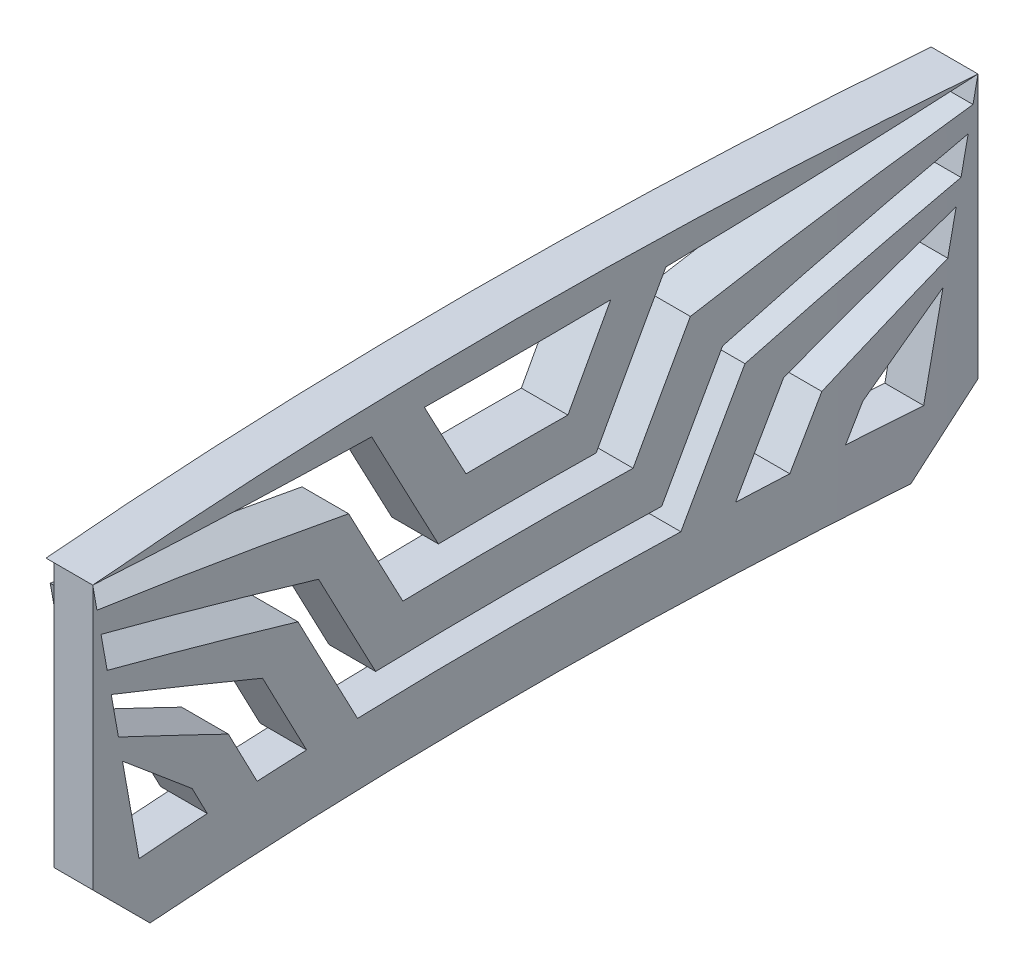
from build123d import *

# Parameters (mm, degrees)
BOSS_EXTRUDE1_DEPTH      = 25
CUT_EXTRUDE1_DEPTH       = 80.24352506
CUT_EXTRUDE1_DEPTH_BACK  = 80.24352506
SKETCH4_W                = 163.693306888
SKETCH4_H                = 40.024571377
CUT_EXTRUDE3_START       = 2.86496876
CUT_EXTRUDE3_DEPTH       = 1.701411362
CUT_EXTRUDE3_START_2     = 4
CUT_EXTRUDE3_2_DEPTH     = 21
CUT_EXTRUDE3_START_3     = -19
CUT_EXTRUDE3_3_OUTLINE_W = 1.566380122
CUT_EXTRUDE3_3_OUTLINE_H = 41.625991854
CUT_EXTRUDE3_3_DEPTH     = 3.634613826
CUT_EXTRUDE3_START_4     = -15.365386174
CUT_EXTRUDE3_4_OUTLINE_W = 1.566380122
CUT_EXTRUDE3_4_OUTLINE_H = 4.374008146
CUT_EXTRUDE3_4_DEPTH     = 52.325901807
CUT_EXTRUDE8_DEPTH       = 40.481678639
CUT_EXTRUDE8_DEPTH_BACK  = 40.481678639


with BuildPart() as part:
    # Sketch1 → Boss-Extrude1 (new body)
    with BuildSketch(Plane(origin=(0, 0, 0), x_dir=(1, 0, 0), z_dir=(0, 1, 0))):
        with BuildLine():
            Line((4.907868645, 71.729937519), (8.36496876, 71.729937519))
            Line((8.36496876, 71.729937519), (8.36496876, 74.729937519))
            Line((8.36496876, 74.729937519), (4.907868645, 74.729937519))
            ThreePointArc((4.907868645, 74.729937519), (1.752478587, 73.608534376), (0.01247426, 70.74734295))
            ThreePointArc((0.01247426, 70.74734295), (-7.13503124, 1.229937519), (0.01247426, -68.287467911))
            ThreePointArc((0.01247426, -68.287467911), (1.752478587, -71.148659338), (4.907868645, -72.270062481))
            Line((4.907868645, -72.270062481), (8.36496876, -72.270062481))
            Line((8.36496876, -72.270062481), (8.36496876, -69.270062481))
            Line((8.36496876, -69.270062481), (4.907868645, -69.270062481))
            ThreePointArc((4.907868645, -69.270062481), (3.645712622, -68.821501224), (2.949710891, -67.677024653))
            ThreePointArc((2.949710891, -67.677024653), (-4.13503124, 1.229937519), (2.949710891, 70.136899691))
            ThreePointArc((2.949710891, 70.136899691), (3.645712622, 71.281376262), (4.907868645, 71.729937519))
        make_face()
    extrude(amount=BOSS_EXTRUDE1_DEPTH)

    # Sketch4 → Cut-Extrude1 (cut, two sides: drawn at the far end of the back side and taken through both)
    with BuildSketch(Plane(origin=(0, 0, 0), x_dir=(0, 0, -1), z_dir=(1, 0, 0)).offset(-CUT_EXTRUDE1_DEPTH_BACK)):
        with Locations((-1.406411494, 10.890491369)):
            Rectangle(SKETCH4_W, SKETCH4_H)
        Polygon((25.729937519, 4), (-23.270062481, 4), (-27.270062481, 8), (-27.270062481, 25), (29.729937519, 25), (29.729937519, 8), align=None, mode=Mode.SUBTRACT)
    extrude(amount=CUT_EXTRUDE1_DEPTH + CUT_EXTRUDE1_DEPTH_BACK, mode=Mode.SUBTRACT)

    # Cut-Extrude3: read off the stored shape, not the designer's step
    # Cut-Extrude3 outline → Cut-Extrude3 (cut)
    with BuildSketch(Plane(origin=(-10, 0, 0), x_dir=(0, 0, -1), z_dir=(1, 0, 0)).offset(CUT_EXTRUDE3_START)):
        Polygon((26.491842281, 8), (-24.031967243, 8), (-27.270062481, 25), (-27.270062481, 8), (-23.270062481, 4), (25.729937519, 4), (29.729937519, 8), (29.729937519, 25), align=None)
    extrude(amount=CUT_EXTRUDE3_DEPTH, mode=Mode.SUBTRACT)

    # Cut-Extrude3 2 outline → Cut-Extrude3 2 (add)
    with BuildSketch(Plane(origin=(0, 0, 0), x_dir=(1, 0, 0), z_dir=(0, 1, 0)).offset(CUT_EXTRUDE3_START_2)):
        with BuildLine():
            ThreePointArc((-5.433619878, 29.729937519), (-6.63503124, 1.229937519), (-5.433619878, -27.270062481))
            Line((-5.433619878, -27.270062481), (-5.433619878, 29.729937519))
        make_face()
    extrude(amount=CUT_EXTRUDE3_2_DEPTH)

    # Cut-Extrude3 3 outline → Cut-Extrude3 3 (cut)
    with BuildSketch(Plane(origin=(0, 0, 0), x_dir=(1, 0, 0), z_dir=(0, 0.7071067811865476, 0.7071067811865476)).offset(CUT_EXTRUDE3_START_3)):
        with Locations((-6.216809939, 7.187004073)):
            Rectangle(CUT_EXTRUDE3_3_OUTLINE_W, CUT_EXTRUDE3_3_OUTLINE_H)
    extrude(amount=CUT_EXTRUDE3_3_DEPTH, mode=Mode.SUBTRACT)

    # Cut-Extrude3 4 outline → Cut-Extrude3 4 (cut)
    with BuildSketch(Plane(origin=(0, 0, 0), x_dir=(1, 0, 0), z_dir=(0, 0.7071067811865476, 0.7071067811865476)).offset(CUT_EXTRUDE3_START_4)):
        with Locations((-6.216809939, -15.812995927)):
            Rectangle(CUT_EXTRUDE3_4_OUTLINE_W, CUT_EXTRUDE3_4_OUTLINE_H)
    extrude(amount=CUT_EXTRUDE3_4_DEPTH, mode=Mode.SUBTRACT)

    # Sketch8 → Cut-Extrude8 (cut, two sides: drawn at the far end of the back side and taken through both)
    with BuildSketch(Plane(origin=(-10, 0, 0), x_dir=(0, 0, -1), z_dir=(1, 0, 0)).offset(-CUT_EXTRUDE8_DEPTH_BACK)):
        with BuildLine():
            Line((6.308934185, 15), (1.229937519, 15))
            Line((1.229937519, 15), (1.229937519, 13))
            Line((1.229937519, 13), (8.641627042, 13))
            Line((8.641627042, 13), (12.232486064, 19.719117213))
            Line((12.232486064, 19.719117213), (29.431983471, 23.435741248))
            Line((29.431983471, 23.435741248), (29.729937519, 25))
            ThreePointArc((29.729937519, 25), (20.236755242, 23.88709601), (10.701873099, 23.219947174))
            Line((10.701873099, 23.219947174), (6.308934185, 15))
        make_face()
        with BuildLine():
            Line((1.229937519, 13), (1.229937519, 15))
            Line((1.229937519, 15), (-3.849059147, 15))
            Line((-3.849059147, 15), (-8.241998061, 23.219947174))
            ThreePointArc((-8.241998061, 23.219947174), (-17.776880204, 23.88709601), (-27.270062481, 25))
            Line((-27.270062481, 25), (-26.972108433, 23.435741248))
            Line((-26.972108433, 23.435741248), (-9.772611026, 19.719117213))
            Line((-9.772611026, 19.719117213), (-6.181752003, 13))
            Line((-6.181752003, 13), (1.229937519, 13))
        make_face()
        Polygon((10.439895671, 10), (1.229937519, 10), (1.229937519, 8), (11.638741425, 8), (15.621568327, 15.452556791), (28.719498973, 19.695197632), (29.146269185, 21.935741248), (14.237865718, 17.106657698), align=None)
        Polygon((1.229937519, 8), (1.229937519, 10), (-7.980020633, 10), (-11.77799068, 17.106657698), (-26.686394147, 21.935741248), (-26.259623935, 19.695197632), (-13.161693289, 15.452556791), (-9.178866387, 8), align=None)
        Polygon((18.009568459, 13.556046251), (15.040282736, 8), (18.378948493, 8), (20.33686857, 11.663606509), (27.93038346, 15.552341188), (28.433784687, 18.195197632), align=None)
        Polygon((-17.876993532, 11.663606509), (-15.919073455, 8), (-12.580407697, 8), (-15.54969342, 13.556046251), (-25.973909649, 18.195197632), (-25.470508422, 15.552341188), align=None)
        Polygon((-25.184794136, 14.052341188), (-20.361334539, 9.947366382), (-19.320614766, 8), (-24.031967243, 8), align=None)
        Polygon((22.821209577, 9.947366382), (21.780489804, 8), (26.491842281, 8), (27.644669174, 14.052341188), align=None)
        with BuildLine():
            Line((1.229937519, 23), (1.229937519, 18))
            Line((1.229937519, 18), (4.510665555, 18))
            Line((4.510665555, 18), (7.229937519, 23.088227342))
            ThreePointArc((7.229937519, 23.088227342), (4.230261838, 23.022058028), (1.229937519, 23))
        make_face()
        with BuildLine():
            Line((-2.050790517, 18), (1.229937519, 18))
            Line((1.229937519, 18), (1.229937519, 23))
            ThreePointArc((1.229937519, 23), (-1.770386799, 23.022058028), (-4.770062481, 23.088227342))
            Line((-4.770062481, 23.088227342), (-2.050790517, 18))
        make_face()
    extrude(amount=CUT_EXTRUDE8_DEPTH + CUT_EXTRUDE8_DEPTH_BACK, mode=Mode.SUBTRACT)


with BuildPart() as cut_extrude8_piece_1:
    # of the separate pieces the step leaves, piece 1, a body of its own (cut_extrude8_pieces)
    add(part.part.solids().sort_by_distance((-2.933619878, 8, 27.270062481))[0])


with BuildPart() as cut_extrude8_piece_2:
    # of the separate pieces the step leaves, piece 2, a body of its own (cut_extrude8_pieces)
    add(part.part.solids().sort_by_distance((-4.002538103, 23.219947174, 8.241998061))[0])


solid = Compound([cut_extrude8_piece_1.part, cut_extrude8_piece_2.part])
